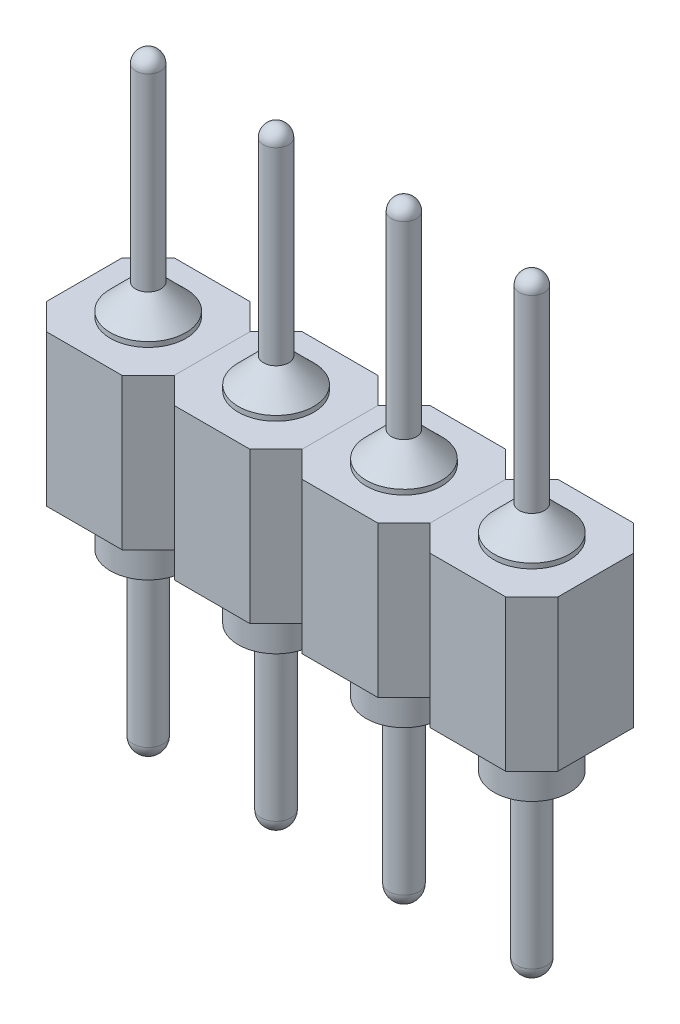
from build123d import *
from build123d.topology import SkipClean

# Parameters (mm, degrees)
EXTRUDE_START          = -1
SKETCH_3_R             = 0.75
EXTRUDE_1_DEPTH        = 3
PATTERN_LINEAR_1_COUNT = 4
PATTERN_LINEAR_1_PITCH = 2.54


with BuildPart() as part:
    # Эскиз2 → Повернуть1 (revolve)
    with SkipClean():  # the faces are left unmerged after this step: merging them gives an invalid solid
        with BuildSketch(Plane.XY):
            with BuildLine():
                Line((0, 11.6), (0, 0.6))
                ThreePointArc((0, 0.6), (0.212132034, 0.512132034), (0.3, 0.3))
                Line((0.3, 0.3), (0.3, 3.5))
                Line((0.3, 3.5), (0.75, 3.5))
                Line((0.75, 3.5), (0.75, 7.6))
                Line((0.75, 7.6), (0.25, 8.1))
                Line((0.25, 8.1), (0.25, 11.85))
                ThreePointArc((0.25, 11.85), (0.176776695, 11.673223305), (0, 11.6))
            make_face()
            with BuildLine():
                ThreePointArc((0, 0.6), (-0.3, 0.3), (0, 0))
                Line((0, 0), (0, 0.6))
            make_face()
            with BuildLine():
                Line((0, 0.6), (0, 0))
                ThreePointArc((0, 0), (0.212132034, 0.087867966), (0.3, 0.3))
                ThreePointArc((0.3, 0.3), (0.212132034, 0.512132034), (0, 0.6))
            make_face()
            with BuildLine():
                ThreePointArc((0, 12.1), (-0.25, 11.85), (0, 11.6))
                Line((0, 11.6), (0, 12.1))
            make_face()
            with BuildLine():
                Line((0, 12.1), (0, 11.6))
                ThreePointArc((0, 11.6), (0.176776695, 11.673223305), (0.25, 11.85))
                ThreePointArc((0.25, 11.85), (0.176776695, 12.026776695), (0, 12.1))
            make_face()
        revolve(axis=Axis((0, 0, 0), (0, 1, 0)))
    add(part.part.scale(1), mode=Mode.REPLACE)  # the faces are merged on a copy


with BuildPart() as body_2:
    # Эскиз3 → Бобышка-Вытянуть1 (new body)
    with BuildSketch(Plane.XZ.offset(-3.5).offset(EXTRUDE_START)):
        Polygon((-0.75, 1.27), (0.75, 1.27), (1.27, 0.75), (1.27, -0.75), (0.75, -1.27), (-0.75, -1.27), (-1.27, -0.75), (-1.27, 0.75), align=None)
        Circle(SKETCH_3_R, mode=Mode.SUBTRACT)
    extrude(amount=-EXTRUDE_1_DEPTH)


with BuildPart() as pattern_linear_1_1:
    # Линейный массив1: pattern copy
    add(part.part.moved(Location(Vector(-1, 0, 0) * (1 * PATTERN_LINEAR_1_PITCH))))


with BuildPart() as pattern_linear_1_2:
    # Линейный массив1: pattern copy
    add(part.part.moved(Location(Vector(-1, 0, 0) * (2 * PATTERN_LINEAR_1_PITCH))))


with BuildPart() as pattern_linear_1_3:
    # Линейный массив1: pattern copy
    add(part.part.moved(Location(Vector(-1, 0, 0) * (3 * PATTERN_LINEAR_1_PITCH))))


with BuildPart() as pattern_linear_1_4:
    # Линейный массив1: pattern copy
    add(body_2.part.moved(Location(Vector(-1, 0, 0) * (1 * PATTERN_LINEAR_1_PITCH))))


with BuildPart() as pattern_linear_1_5:
    # Линейный массив1: pattern copy
    add(body_2.part.moved(Location(Vector(-1, 0, 0) * (2 * PATTERN_LINEAR_1_PITCH))))


with BuildPart() as pattern_linear_1_6:
    # Линейный массив1: pattern copy
    add(body_2.part.moved(Location(Vector(-1, 0, 0) * (3 * PATTERN_LINEAR_1_PITCH))))


solid = Compound([part.part, body_2.part, pattern_linear_1_1.part, pattern_linear_1_2.part, pattern_linear_1_3.part, pattern_linear_1_4.part, pattern_linear_1_5.part, pattern_linear_1_6.part])
